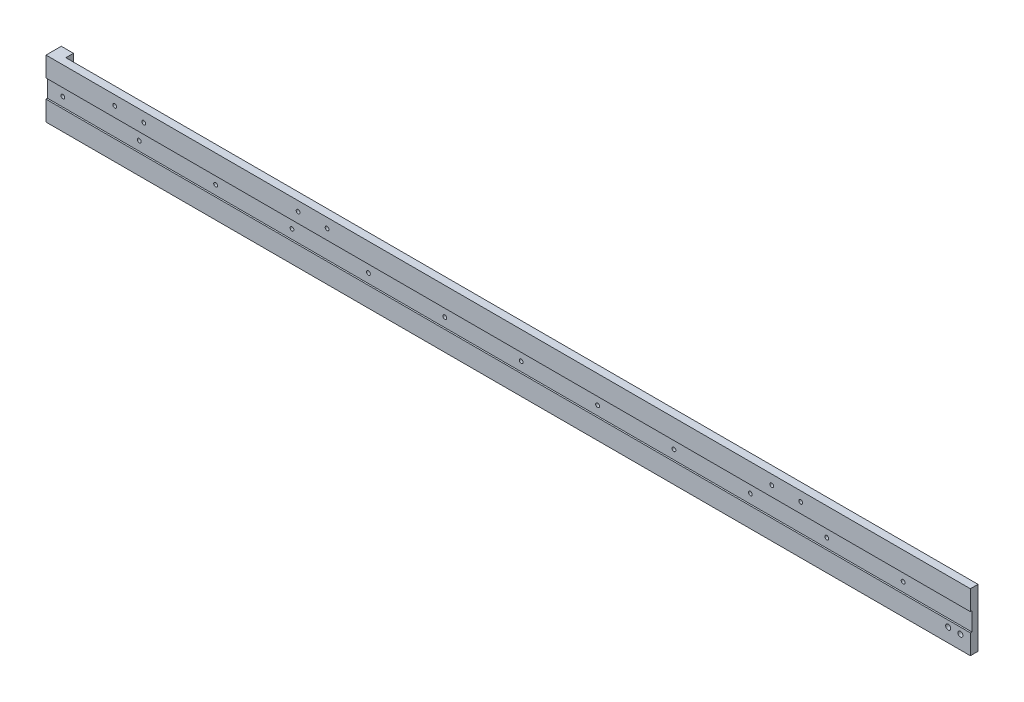
from build123d import *

# Parameters (mm, degrees)
SKETCH_1_W                  = 595
SKETCH_1_H                  = 38
EXTRUDE_1_DEPTH             = 5
HOLE_WIZARD_M3_1_D          = 2.5
PATTERN_LINEAR_1_COUNT      = 12
PATTERN_LINEAR_1_PITCH      = 50
SKETCH_4_W                  = 595
SKETCH_4_H                  = 12
CUT_EXTRUDE_1_DEPTH         = 1
SKETCH_5_W                  = 5
SKETCH_5_H                  = 38
EXTRUDE_2_DEPTH             = 8
HOLE_WIZARD_M4_1_D          = 3.3
HOLE_WIZARD_M4_1_DEPTH      = 6
HOLE_WIZARD_M4_1_TIP        = 0.991420021
EXTRUDE_3_DEPTH             = 10
HOLE_WIZARD_M4_2_D          = 3.3
HOLE_WIZARD_M4_2_DEPTH      = 10.1
HOLE_WIZARD_M4_2_TIP        = 0.991420021
HOLE_WIZARD_M3_2_AT_2_COUNT = 2
HOLE_WIZARD_M3_2_AT_2_PITCH = 19
PATTERN_LINEAR_2_COUNT      = 2
PATTERN_LINEAR_2_PITCH      = 120
PATTERN_LINEAR_3_COUNT      = 2
PATTERN_LINEAR_3_PITCH      = 430


with BuildPart() as part:
    # 草图1 → 凸台-拉伸1 (new body)
    with BuildSketch(Plane.XY):
        with Locations((297.5, 19)):
            Rectangle(SKETCH_1_W, SKETCH_1_H)
    extrude(amount=EXTRUDE_1_DEPTH)

    # M3 螺纹孔1 (through all)
    with Locations(Plane.XY.offset(5)):
        with Locations((10, 19)):
            hole_wizard_m3_1 = Hole(HOLE_WIZARD_M3_1_D / 2)

    # 阵列(线性)1: M3 螺纹孔1 ×12
    with Locations(*[(i * PATTERN_LINEAR_1_PITCH, 0, 0) for i in range(1, PATTERN_LINEAR_1_COUNT)]):
        add(hole_wizard_m3_1, mode=Mode.SUBTRACT)

    # 草图4 → 切除-拉伸1 (cut)
    with BuildSketch(Plane.XY.offset(5)):
        with Locations((297.5, 19)):
            Rectangle(SKETCH_4_W, SKETCH_4_H)
    extrude(amount=-CUT_EXTRUDE_1_DEPTH, mode=Mode.SUBTRACT)

    # 草图5 → 凸台-拉伸2 (add)
    with BuildSketch(Plane.ZY):
        with Locations((-2.5, 19)):
            Rectangle(SKETCH_5_W, SKETCH_5_H)
    extrude(amount=-EXTRUDE_2_DEPTH)

    # M4 螺纹孔1
    with Locations(Plane.ZY):
        with Locations((0.69552528, 14), (0.69552528, 4)):
            Hole(HOLE_WIZARD_M4_1_D / 2, depth=HOLE_WIZARD_M4_1_DEPTH)
            with Locations((0, 0, -(HOLE_WIZARD_M4_1_DEPTH + HOLE_WIZARD_M4_1_TIP / 2))):  # 118° drill point
                Cone(0, HOLE_WIZARD_M4_1_D / 2, HOLE_WIZARD_M4_1_TIP, mode=Mode.SUBTRACT)

    # 草图8 → 凸台-拉伸3 (add)
    with BuildSketch(Plane(origin=(595, 0, 0), x_dir=(0, 0, -1), z_dir=(1, 0, 0))):
        Polygon((-5, 0), (-5, 13), (-4, 13), (-4, 25), (-5, 25), (-5, 38), (0, 38), (0, 0), align=None)
    extrude(amount=EXTRUDE_3_DEPTH)

    # M4 螺纹孔2
    with Locations(Plane.XY.offset(5)):
        with Locations((598.5, 9.00237217), (590.5, 9.00237217)):
            Hole(HOLE_WIZARD_M4_2_D / 2, depth=HOLE_WIZARD_M4_2_DEPTH)
            with Locations((0, 0, -(HOLE_WIZARD_M4_2_DEPTH + HOLE_WIZARD_M4_2_TIP / 2))):  # 118° drill point
                Cone(0, HOLE_WIZARD_M4_2_D / 2, HOLE_WIZARD_M4_2_TIP, mode=Mode.SUBTRACT)

    # 草图13 → M3 螺纹孔2 (revolve, cut)
    with BuildSketch(Plane(origin=(44.992811473, 31.7, 0), x_dir=(0, 1, 0), z_dir=(1, 0, 0))):
        Polygon((0, 0), (0, 8.251075774), (1.25, 7.5), (1.25, 0), align=None)
    hole_wizard_m3_2 = revolve(axis=Axis((44.992811473, 31.7, -6.35), (0, 0, 1)), mode=Mode.SUBTRACT)

    # M3 螺纹孔2 at 2: M3 螺纹孔2 ×2
    with Locations(*[(i * HOLE_WIZARD_M3_2_AT_2_PITCH, 0, 0) for i in range(1, HOLE_WIZARD_M3_2_AT_2_COUNT)]):
        add(hole_wizard_m3_2, mode=Mode.SUBTRACT)

    # 阵列(线性)2: M3 螺纹孔2 ×2
    with Locations(*[(i * PATTERN_LINEAR_2_PITCH, 0, 0) for i in range(1, PATTERN_LINEAR_2_COUNT)]):
        add(hole_wizard_m3_2, mode=Mode.SUBTRACT)

    # 阵列(线性)2 copy 1 sketch → 阵列(线性)2 copy 1 (revolve, cut)
    with BuildSketch(Plane(origin=(183.992811473, 31.7, 0), x_dir=(0, 1, 0), z_dir=(1, 0, 0))):
        Polygon((0, 0), (0, 8.251075774), (1.25, 7.5), (1.25, 0), align=None)
    revolve(axis=Axis((183.992811473, 31.7, -6.35), (0, 0, 1)), mode=Mode.SUBTRACT)

    # 阵列(线性)3: M3 螺纹孔2 ×2
    with Locations(*[(i * PATTERN_LINEAR_3_PITCH, 0, 0) for i in range(1, PATTERN_LINEAR_3_COUNT)]):
        add(hole_wizard_m3_2, mode=Mode.SUBTRACT)

    # 阵列(线性)3 copy 1 sketch → 阵列(线性)3 copy 1 (revolve, cut)
    with BuildSketch(Plane(origin=(493.992811473, 31.7, 0), x_dir=(0, 1, 0), z_dir=(1, 0, 0))):
        Polygon((0, 0), (0, 8.251075774), (1.25, 7.5), (1.25, 0), align=None)
    revolve(axis=Axis((493.992811473, 31.7, -6.35), (0, 0, 1)), mode=Mode.SUBTRACT)


solid = part.part
